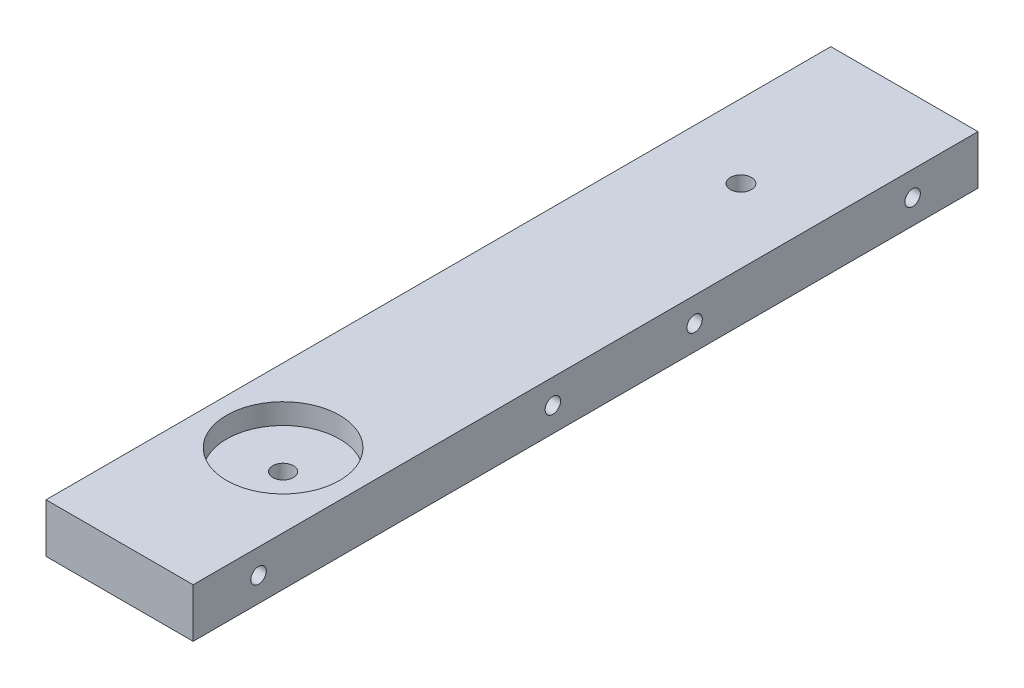
from build123d import *

# Parameters (mm, degrees)
SKETCH2_W             = 28.575
SKETCH2_H             = 152.4
BOSS_EXTRUDE1_DEPTH   = 9.525
F_3_0MM_DOWEL_HOLE1_D = 3
LPATTERN1_COUNT       = 4
LPATTERN1_PITCH       = 42.333333333
F_3_0MM_DOWEL_HOLE2_D = 3
SKETCH12_R            = 2.05
CUT_EXTRUDE1_DEPTH    = 156.348048749
SKETCH12_4_R          = 10.975
CUT_EXTRUDE2_DEPTH    = 4
SKETCH15_R            = 2
CUT_EXTRUDE3_DEPTH    = 156.154169296


with BuildPart() as part:
    # Sketch2 → Boss-Extrude1 (new body)
    with BuildSketch(Plane(origin=(0, 0, 0), x_dir=(1, 0, 0), z_dir=(0, 1, 0))):
        with Locations((14.2875, 76.2)):
            Rectangle(SKETCH2_W, SKETCH2_H)
    extrude(amount=BOSS_EXTRUDE1_DEPTH)

    # Ø3.0mm Dowel Hole1 (through all)
    with Locations(Plane.ZY):
        with Locations((-139.7, 4.7625)):
            f_3_0mm_dowel_hole1 = Hole(F_3_0MM_DOWEL_HOLE1_D / 2)

    # LPattern1: Ø3.0mm Dowel Hole1 ×4, 1 skipped
    with Locations(*[(0, 0, i * LPATTERN1_PITCH) for i in range(1, LPATTERN1_COUNT) if i not in (2,)]):
        add(f_3_0mm_dowel_hole1, mode=Mode.SUBTRACT)

    # Ø3.0mm Dowel Hole2 (through all)
    with Locations(Plane.ZY):
        with Locations((-69.85, 4.7625)):
            Hole(F_3_0MM_DOWEL_HOLE2_D / 2)

    # Sketch12 → Cut-Extrude1 (cut, through all)
    with BuildSketch(Plane(origin=(0, 9.525, 0), x_dir=(1, 0, 0), z_dir=(0, 1, 0))):
        with Locations((14.2875, 120.65)):
            Circle(SKETCH12_R)
    extrude(amount=-CUT_EXTRUDE1_DEPTH, mode=Mode.SUBTRACT)

    # Sketch12<4> → Cut-Extrude2 (cut)
    with BuildSketch(Plane(origin=(0, 9.525, 0), x_dir=(1, 0, 0), z_dir=(0, 1, 0))):
        with Locations((14.2875, 31.75)):
            Circle(SKETCH12_4_R)
    extrude(amount=-CUT_EXTRUDE2_DEPTH, mode=Mode.SUBTRACT)

    # Sketch15 → Cut-Extrude3 (cut, through all)
    with BuildSketch(Plane(origin=(0, 5.525, 0), x_dir=(1, 0, 0), z_dir=(0, 1, 0))):
        with Locations((14.2875, 31.75)):
            Circle(SKETCH15_R)
    extrude(amount=-CUT_EXTRUDE3_DEPTH, mode=Mode.SUBTRACT)


solid = part.part
